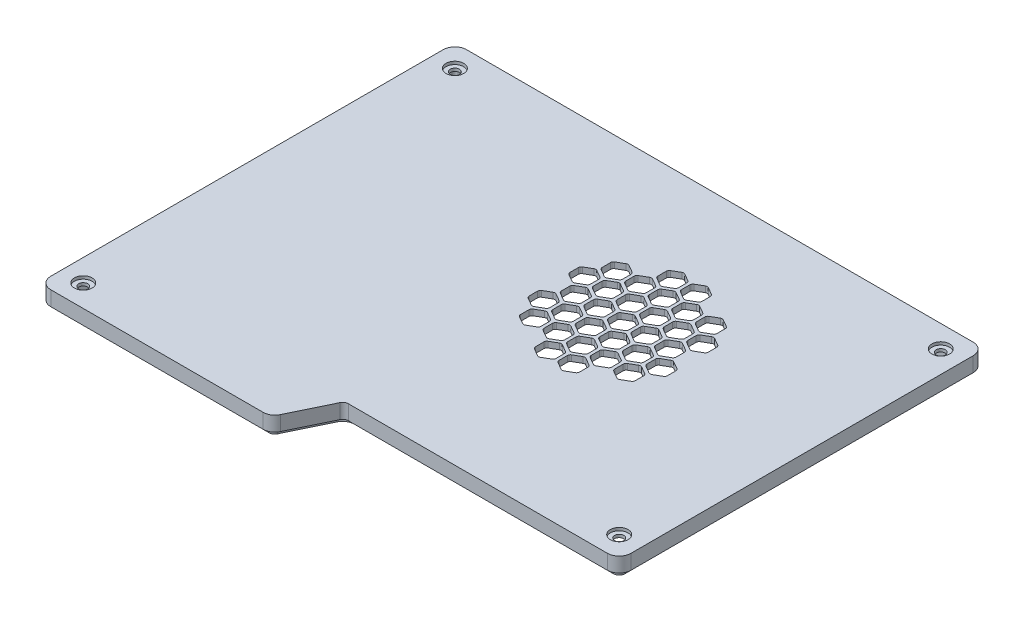
from build123d import *

# Parameters (mm, degrees)
EXTRUDE_1_DEPTH     = 5
CUT_EXTRUDE_1_DEPTH = 3
EXTRUDE_2_DEPTH     = 2
CUT_EXTRUDE_2_DEPTH = 2
FILLET_1_R          = 1
OTHER_START         = 3
OTHER_1_DEPTH       = 2
FILLET_2_R          = 4
FILLET_3_R          = 2
FILLET_4_R          = 1
FILLET_5_R          = 6
SKETCH_8_R          = 1.55
CUT_EXTRUDE_3_DEPTH = 2
SKETCH_9_R          = 3
CUT_EXTRUDE_4_DEPTH = 1


# Read off the part's stored shape, not the designer's step: 填充阵列1
with BuildPart() as part:
    # 草图1 → 凸台-拉伸1 (new body)
    with BuildSketch(Plane(origin=(0, 0, 0), x_dir=(1, 0, 0), z_dir=(0, 1, 0))):
        Polygon((0, 0), (0, 141.2), (180, 141.2), (180, 17), (86.8, 17), (78.6, 0), align=None)
    extrude(amount=EXTRUDE_1_DEPTH)

    # 草图4 → 切除-拉伸1 (cut)
    with BuildSketch(Plane.XZ):
        Polygon((4, -4), (4, -137.2), (176, -137.2), (176, -21), (84.288395017, -21), (76.088395017, -4), align=None)
    extrude(amount=-CUT_EXTRUDE_1_DEPTH, mode=Mode.SUBTRACT)

    # 草图5 → 凸台-拉伸2 (add)
    with BuildSketch(Plane.XZ):
        Polygon((2, -2), (2, -139.2), (178, -139.2), (178, -19), (85.544197508, -19), (77.344197508, -2), align=None)
        Polygon((4, -4), (4, -137.2), (176, -137.2), (176, -21), (84.288395017, -21), (76.088395017, -4), align=None, mode=Mode.SUBTRACT)
    extrude(amount=EXTRUDE_2_DEPTH)

    # 草图7 → 切除-拉伸2 (cut)
    with BuildSketch(Plane.XZ.offset(-3)):
        Polygon((110.5, -91.77), (113.964101615, -89.77), (113.964101615, -85.77), (110.5, -83.77), (107.035898385, -85.77), (107.035898385, -89.77), align=None)
    extrude(amount=-CUT_EXTRUDE_2_DEPTH, mode=Mode.SUBTRACT)

    # 圆角1
    fillet_1_edges = [part.edges().sort_by_distance(p)[0] for p in [
        (110.5, 4, -91.77),
        (107.035898385, 4, -89.77),
        (107.035898385, 4, -85.77),
        (110.5, 4, -83.77),
        (113.964101615, 4, -85.77),
        (113.964101615, 4, -89.77),
    ]]
    fillet(fillet_1_edges, radius=FILLET_1_R)

    # 填充阵列1 outline → 填充阵列1 (cut)
    with BuildSketch(Plane(origin=(0, 0, 0), x_dir=(1, 0, 0), z_dir=(0, 1, 0)).offset(OTHER_START)):
        with BuildLine():
            ThreePointArc((123, 98.409528096), (122.5, 98.543502692), (122, 98.409528096))
            Line((122, 98.409528096), (119.535898385, 96.986878365))
            ThreePointArc((119.535898385, 96.986878365), (119.169872981, 96.620852961), (119.035898385, 96.120852961))
            Line((119.035898385, 96.120852961), (119.035898385, 93.275553499))
            ThreePointArc((119.035898385, 93.275553499), (119.169872981, 92.775553499), (119.535898385, 92.409528096))
            Line((119.535898385, 92.409528096), (122, 90.986878365))
            ThreePointArc((122, 90.986878365), (122.5, 90.852903769), (123, 90.986878365))
            Line((123, 90.986878365), (125.464101615, 92.409528096))
            ThreePointArc((125.464101615, 92.409528096), (125.830127019, 92.775553499), (125.964101615, 93.275553499))
            Line((125.964101615, 93.275553499), (125.964101615, 96.120852961))
            ThreePointArc((125.964101615, 96.120852961), (125.830127019, 96.620852961), (125.464101615, 96.986878365))
            Line((125.464101615, 96.986878365), (123, 98.409528096))
        make_face()
        with BuildLine():
            ThreePointArc((99, 84.553121635), (98.5, 84.687096231), (98, 84.553121635))
            Line((98, 84.553121635), (95.535898385, 83.130471904))
            ThreePointArc((95.535898385, 83.130471904), (95.169872981, 82.764446501), (95.035898385, 82.264446501))
            Line((95.035898385, 82.264446501), (95.035898385, 79.419147039))
            ThreePointArc((95.035898385, 79.419147039), (95.169872981, 78.919147039), (95.535898385, 78.553121635))
            Line((95.535898385, 78.553121635), (98, 77.130471904))
            ThreePointArc((98, 77.130471904), (98.5, 76.996497308), (99, 77.130471904))
            Line((99, 77.130471904), (101.464101615, 78.553121635))
            ThreePointArc((101.464101615, 78.553121635), (101.830127019, 78.919147039), (101.964101615, 79.419147039))
            Line((101.964101615, 79.419147039), (101.964101615, 82.264446501))
            ThreePointArc((101.964101615, 82.264446501), (101.830127019, 82.764446501), (101.464101615, 83.130471904))
            Line((101.464101615, 83.130471904), (99, 84.553121635))
        make_face()
        with BuildLine():
            ThreePointArc((107.535898385, 76.202268674), (107.169872981, 75.83624327), (107.035898385, 75.33624327))
            Line((107.035898385, 75.33624327), (107.035898385, 72.490943809))
            ThreePointArc((107.035898385, 72.490943809), (107.169872981, 71.990943809), (107.535898385, 71.624918405))
            Line((107.535898385, 71.624918405), (110, 70.202268674))
            ThreePointArc((110, 70.202268674), (110.5, 70.068294078), (111, 70.202268674))
            Line((111, 70.202268674), (113.464101615, 71.624918405))
            ThreePointArc((113.464101615, 71.624918405), (113.830127019, 71.990943809), (113.964101615, 72.490943809))
            Line((113.964101615, 72.490943809), (113.964101615, 75.33624327))
            ThreePointArc((113.964101615, 75.33624327), (113.830127019, 75.83624327), (113.464101615, 76.202268674))
            Line((113.464101615, 76.202268674), (111, 77.624918405))
            ThreePointArc((111, 77.624918405), (110.5, 77.758893001), (110, 77.624918405))
            Line((110, 77.624918405), (107.535898385, 76.202268674))
        make_face()
        with BuildLine():
            ThreePointArc((107.535898385, 103.915081595), (107.169872981, 103.549056191), (107.035898385, 103.049056191))
            Line((107.035898385, 103.049056191), (107.035898385, 100.20375673))
            ThreePointArc((107.035898385, 100.20375673), (107.169872981, 99.70375673), (107.535898385, 99.337731326))
            Line((107.535898385, 99.337731326), (110, 97.915081595))
            ThreePointArc((110, 97.915081595), (110.5, 97.781106999), (111, 97.915081595))
            Line((111, 97.915081595), (113.464101615, 99.337731326))
            ThreePointArc((113.464101615, 99.337731326), (113.830127019, 99.70375673), (113.964101615, 100.20375673))
            Line((113.964101615, 100.20375673), (113.964101615, 103.049056191))
            ThreePointArc((113.964101615, 103.049056191), (113.830127019, 103.549056191), (113.464101615, 103.915081595))
            Line((113.464101615, 103.915081595), (111, 105.337731326))
            ThreePointArc((111, 105.337731326), (110.5, 105.471705922), (110, 105.337731326))
            Line((110, 105.337731326), (107.535898385, 103.915081595))
        make_face()
        with BuildLine():
            ThreePointArc((119.035898385, 79.419147039), (119.169872981, 78.919147039), (119.535898385, 78.553121635))
            Line((119.535898385, 78.553121635), (122, 77.130471904))
            ThreePointArc((122, 77.130471904), (122.5, 76.996497308), (123, 77.130471904))
            Line((123, 77.130471904), (125.464101615, 78.553121635))
            ThreePointArc((125.464101615, 78.553121635), (125.830127019, 78.919147039), (125.964101615, 79.419147039))
            Line((125.964101615, 79.419147039), (125.964101615, 82.264446501))
            ThreePointArc((125.964101615, 82.264446501), (125.830127019, 82.764446501), (125.464101615, 83.130471904))
            Line((125.464101615, 83.130471904), (123, 84.553121635))
            ThreePointArc((123, 84.553121635), (122.5, 84.687096231), (122, 84.553121635))
            Line((122, 84.553121635), (119.535898385, 83.130471904))
            ThreePointArc((119.535898385, 83.130471904), (119.169872981, 82.764446501), (119.035898385, 82.264446501))
            Line((119.035898385, 82.264446501), (119.035898385, 79.419147039))
        make_face()
        with BuildLine():
            ThreePointArc((95.035898385, 93.275553499), (95.169872981, 92.775553499), (95.535898385, 92.409528096))
            Line((95.535898385, 92.409528096), (98, 90.986878365))
            ThreePointArc((98, 90.986878365), (98.5, 90.852903769), (99, 90.986878365))
            Line((99, 90.986878365), (101.464101615, 92.409528096))
            ThreePointArc((101.464101615, 92.409528096), (101.830127019, 92.775553499), (101.964101615, 93.275553499))
            Line((101.964101615, 93.275553499), (101.964101615, 96.120852961))
            ThreePointArc((101.964101615, 96.120852961), (101.830127019, 96.620852961), (101.464101615, 96.986878365))
            Line((101.464101615, 96.986878365), (99, 98.409528096))
            ThreePointArc((99, 98.409528096), (98.5, 98.543502692), (98, 98.409528096))
            Line((98, 98.409528096), (95.535898385, 96.986878365))
            ThreePointArc((95.535898385, 96.986878365), (95.169872981, 96.620852961), (95.035898385, 96.120852961))
            Line((95.035898385, 96.120852961), (95.035898385, 93.275553499))
        make_face()
        with BuildLine():
            ThreePointArc((91, 98.409528096), (90.5, 98.543502692), (90, 98.409528096))
            Line((90, 98.409528096), (87.535898385, 96.986878365))
            ThreePointArc((87.535898385, 96.986878365), (87.169872981, 96.620852961), (87.035898385, 96.120852961))
            Line((87.035898385, 96.120852961), (87.035898385, 93.275553499))
            ThreePointArc((87.035898385, 93.275553499), (87.169872981, 92.775553499), (87.535898385, 92.409528096))
            Line((87.535898385, 92.409528096), (90, 90.986878365))
            ThreePointArc((90, 90.986878365), (90.5, 90.852903769), (91, 90.986878365))
            Line((91, 90.986878365), (93.464101615, 92.409528096))
            ThreePointArc((93.464101615, 92.409528096), (93.830127019, 92.775553499), (93.964101615, 93.275553499))
            Line((93.964101615, 93.275553499), (93.964101615, 96.120852961))
            ThreePointArc((93.964101615, 96.120852961), (93.830127019, 96.620852961), (93.464101615, 96.986878365))
            Line((93.464101615, 96.986878365), (91, 98.409528096))
        make_face()
        with BuildLine():
            ThreePointArc((103, 105.337731326), (102.5, 105.471705922), (102, 105.337731326))
            Line((102, 105.337731326), (99.535898385, 103.915081595))
            ThreePointArc((99.535898385, 103.915081595), (99.169872981, 103.549056191), (99.035898385, 103.049056191))
            Line((99.035898385, 103.049056191), (99.035898385, 100.20375673))
            ThreePointArc((99.035898385, 100.20375673), (99.169872981, 99.70375673), (99.535898385, 99.337731326))
            Line((99.535898385, 99.337731326), (102, 97.915081595))
            ThreePointArc((102, 97.915081595), (102.5, 97.781106999), (103, 97.915081595))
            Line((103, 97.915081595), (105.464101615, 99.337731326))
            ThreePointArc((105.464101615, 99.337731326), (105.830127019, 99.70375673), (105.964101615, 100.20375673))
            Line((105.964101615, 100.20375673), (105.964101615, 103.049056191))
            ThreePointArc((105.964101615, 103.049056191), (105.830127019, 103.549056191), (105.464101615, 103.915081595))
            Line((105.464101615, 103.915081595), (103, 105.337731326))
        make_face()
        with BuildLine():
            ThreePointArc((115, 112.265934556), (114.5, 112.399909152), (114, 112.265934556))
            Line((114, 112.265934556), (111.535898385, 110.843284825))
            ThreePointArc((111.535898385, 110.843284825), (111.169872981, 110.477259422), (111.035898385, 109.977259422))
            Line((111.035898385, 109.977259422), (111.035898385, 107.13195996))
            ThreePointArc((111.035898385, 107.13195996), (111.169872981, 106.63195996), (111.535898385, 106.265934556))
            Line((111.535898385, 106.265934556), (114, 104.843284825))
            ThreePointArc((114, 104.843284825), (114.5, 104.709310229), (115, 104.843284825))
            Line((115, 104.843284825), (117.464101615, 106.265934556))
            ThreePointArc((117.464101615, 106.265934556), (117.830127019, 106.63195996), (117.964101615, 107.13195996))
            Line((117.964101615, 107.13195996), (117.964101615, 109.977259422))
            ThreePointArc((117.964101615, 109.977259422), (117.830127019, 110.477259422), (117.464101615, 110.843284825))
            Line((117.464101615, 110.843284825), (115, 112.265934556))
        make_face()
        with BuildLine():
            ThreePointArc((87.535898385, 83.130471904), (87.169872981, 82.764446501), (87.035898385, 82.264446501))
            Line((87.035898385, 82.264446501), (87.035898385, 79.419147039))
            ThreePointArc((87.035898385, 79.419147039), (87.169872981, 78.919147039), (87.535898385, 78.553121635))
            Line((87.535898385, 78.553121635), (90, 77.130471904))
            ThreePointArc((90, 77.130471904), (90.5, 76.996497308), (91, 77.130471904))
            Line((91, 77.130471904), (93.464101615, 78.553121635))
            ThreePointArc((93.464101615, 78.553121635), (93.830127019, 78.919147039), (93.964101615, 79.419147039))
            Line((93.964101615, 79.419147039), (93.964101615, 82.264446501))
            ThreePointArc((93.964101615, 82.264446501), (93.830127019, 82.764446501), (93.464101615, 83.130471904))
            Line((93.464101615, 83.130471904), (91, 84.553121635))
            ThreePointArc((91, 84.553121635), (90.5, 84.687096231), (90, 84.553121635))
            Line((90, 84.553121635), (87.535898385, 83.130471904))
        make_face()
        with BuildLine():
            ThreePointArc((111.035898385, 79.419147039), (111.169872981, 78.919147039), (111.535898385, 78.553121635))
            Line((111.535898385, 78.553121635), (114, 77.130471904))
            ThreePointArc((114, 77.130471904), (114.5, 76.996497308), (115, 77.130471904))
            Line((115, 77.130471904), (117.464101615, 78.553121635))
            ThreePointArc((117.464101615, 78.553121635), (117.830127019, 78.919147039), (117.964101615, 79.419147039))
            Line((117.964101615, 79.419147039), (117.964101615, 82.264446501))
            ThreePointArc((117.964101615, 82.264446501), (117.830127019, 82.764446501), (117.464101615, 83.130471904))
            Line((117.464101615, 83.130471904), (115, 84.553121635))
            ThreePointArc((115, 84.553121635), (114.5, 84.687096231), (114, 84.553121635))
            Line((114, 84.553121635), (111.535898385, 83.130471904))
            ThreePointArc((111.535898385, 83.130471904), (111.169872981, 82.764446501), (111.035898385, 82.264446501))
            Line((111.035898385, 82.264446501), (111.035898385, 79.419147039))
        make_face()
        with BuildLine():
            ThreePointArc((123.035898385, 72.490943809), (123.169872981, 71.990943809), (123.535898385, 71.624918405))
            Line((123.535898385, 71.624918405), (126, 70.202268674))
            ThreePointArc((126, 70.202268674), (126.5, 70.068294078), (127, 70.202268674))
            Line((127, 70.202268674), (129.464101615, 71.624918405))
            ThreePointArc((129.464101615, 71.624918405), (129.830127019, 71.990943809), (129.964101615, 72.490943809))
            Line((129.964101615, 72.490943809), (129.964101615, 75.33624327))
            ThreePointArc((129.964101615, 75.33624327), (129.830127019, 75.83624327), (129.464101615, 76.202268674))
            Line((129.464101615, 76.202268674), (127, 77.624918405))
            ThreePointArc((127, 77.624918405), (126.5, 77.758893001), (126, 77.624918405))
            Line((126, 77.624918405), (123.535898385, 76.202268674))
            ThreePointArc((123.535898385, 76.202268674), (123.169872981, 75.83624327), (123.035898385, 75.33624327))
            Line((123.035898385, 75.33624327), (123.035898385, 72.490943809))
        make_face()
        with BuildLine():
            ThreePointArc((99.035898385, 86.347350269), (99.169872981, 85.847350269), (99.535898385, 85.481324865))
            Line((99.535898385, 85.481324865), (102, 84.058675135))
            ThreePointArc((102, 84.058675135), (102.5, 83.924700538), (103, 84.058675135))
            Line((103, 84.058675135), (105.464101615, 85.481324865))
            ThreePointArc((105.464101615, 85.481324865), (105.830127019, 85.847350269), (105.964101615, 86.347350269))
            Line((105.964101615, 86.347350269), (105.964101615, 89.192649731))
            ThreePointArc((105.964101615, 89.192649731), (105.830127019, 89.692649731), (105.464101615, 90.058675135))
            Line((105.464101615, 90.058675135), (103, 91.481324865))
            ThreePointArc((103, 91.481324865), (102.5, 91.615299462), (102, 91.481324865))
            Line((102, 91.481324865), (99.535898385, 90.058675135))
            ThreePointArc((99.535898385, 90.058675135), (99.169872981, 89.692649731), (99.035898385, 89.192649731))
            Line((99.035898385, 89.192649731), (99.035898385, 86.347350269))
        make_face()
        with BuildLine():
            ThreePointArc((115, 70.696715175), (114.5, 70.830689771), (114, 70.696715175))
            Line((114, 70.696715175), (111.535898385, 69.274065444))
            ThreePointArc((111.535898385, 69.274065444), (111.169872981, 68.90804004), (111.035898385, 68.40804004))
            Line((111.035898385, 68.40804004), (111.035898385, 65.562740578))
            ThreePointArc((111.035898385, 65.562740578), (111.169872981, 65.062740578), (111.535898385, 64.696715175))
            Line((111.535898385, 64.696715175), (114, 63.274065444))
            ThreePointArc((114, 63.274065444), (114.5, 63.140090848), (115, 63.274065444))
            Line((115, 63.274065444), (117.464101615, 64.696715175))
            ThreePointArc((117.464101615, 64.696715175), (117.830127019, 65.062740578), (117.964101615, 65.562740578))
            Line((117.964101615, 65.562740578), (117.964101615, 68.40804004))
            ThreePointArc((117.964101615, 68.40804004), (117.830127019, 68.90804004), (117.464101615, 69.274065444))
            Line((117.464101615, 69.274065444), (115, 70.696715175))
        make_face()
        with BuildLine():
            ThreePointArc((111.535898385, 96.986878365), (111.169872981, 96.620852961), (111.035898385, 96.120852961))
            Line((111.035898385, 96.120852961), (111.035898385, 93.275553499))
            ThreePointArc((111.035898385, 93.275553499), (111.169872981, 92.775553499), (111.535898385, 92.409528096))
            Line((111.535898385, 92.409528096), (114, 90.986878365))
            ThreePointArc((114, 90.986878365), (114.5, 90.852903769), (115, 90.986878365))
            Line((115, 90.986878365), (117.464101615, 92.409528096))
            ThreePointArc((117.464101615, 92.409528096), (117.830127019, 92.775553499), (117.964101615, 93.275553499))
            Line((117.964101615, 93.275553499), (117.964101615, 96.120852961))
            ThreePointArc((117.964101615, 96.120852961), (117.830127019, 96.620852961), (117.464101615, 96.986878365))
            Line((117.464101615, 96.986878365), (115, 98.409528096))
            ThreePointArc((115, 98.409528096), (114.5, 98.543502692), (114, 98.409528096))
            Line((114, 98.409528096), (111.535898385, 96.986878365))
        make_face()
        with BuildLine():
            ThreePointArc((99.035898385, 72.490943809), (99.169872981, 71.990943809), (99.535898385, 71.624918405))
            Line((99.535898385, 71.624918405), (102, 70.202268674))
            ThreePointArc((102, 70.202268674), (102.5, 70.068294078), (103, 70.202268674))
            Line((103, 70.202268674), (105.464101615, 71.624918405))
            ThreePointArc((105.464101615, 71.624918405), (105.830127019, 71.990943809), (105.964101615, 72.490943809))
            Line((105.964101615, 72.490943809), (105.964101615, 75.33624327))
            ThreePointArc((105.964101615, 75.33624327), (105.830127019, 75.83624327), (105.464101615, 76.202268674))
            Line((105.464101615, 76.202268674), (103, 77.624918405))
            ThreePointArc((103, 77.624918405), (102.5, 77.758893001), (102, 77.624918405))
            Line((102, 77.624918405), (99.535898385, 76.202268674))
            ThreePointArc((99.535898385, 76.202268674), (99.169872981, 75.83624327), (99.035898385, 75.33624327))
            Line((99.035898385, 75.33624327), (99.035898385, 72.490943809))
        make_face()
        with BuildLine():
            ThreePointArc((119, 77.624918405), (118.5, 77.758893001), (118, 77.624918405))
            Line((118, 77.624918405), (115.535898385, 76.202268674))
            ThreePointArc((115.535898385, 76.202268674), (115.169872981, 75.83624327), (115.035898385, 75.33624327))
            Line((115.035898385, 75.33624327), (115.035898385, 72.490943809))
            ThreePointArc((115.035898385, 72.490943809), (115.169872981, 71.990943809), (115.535898385, 71.624918405))
            Line((115.535898385, 71.624918405), (118, 70.202268674))
            ThreePointArc((118, 70.202268674), (118.5, 70.068294078), (119, 70.202268674))
            Line((119, 70.202268674), (121.464101615, 71.624918405))
            ThreePointArc((121.464101615, 71.624918405), (121.830127019, 71.990943809), (121.964101615, 72.490943809))
            Line((121.964101615, 72.490943809), (121.964101615, 75.33624327))
            ThreePointArc((121.964101615, 75.33624327), (121.830127019, 75.83624327), (121.464101615, 76.202268674))
            Line((121.464101615, 76.202268674), (119, 77.624918405))
        make_face()
        with BuildLine():
            ThreePointArc((107, 70.696715175), (106.5, 70.830689771), (106, 70.696715175))
            Line((106, 70.696715175), (103.535898385, 69.274065444))
            ThreePointArc((103.535898385, 69.274065444), (103.169872981, 68.90804004), (103.035898385, 68.40804004))
            Line((103.035898385, 68.40804004), (103.035898385, 65.562740578))
            ThreePointArc((103.035898385, 65.562740578), (103.169872981, 65.062740578), (103.535898385, 64.696715175))
            Line((103.535898385, 64.696715175), (106, 63.274065444))
            ThreePointArc((106, 63.274065444), (106.5, 63.140090848), (107, 63.274065444))
            Line((107, 63.274065444), (109.464101615, 64.696715175))
            ThreePointArc((109.464101615, 64.696715175), (109.830127019, 65.062740578), (109.964101615, 65.562740578))
            Line((109.964101615, 65.562740578), (109.964101615, 68.40804004))
            ThreePointArc((109.964101615, 68.40804004), (109.830127019, 68.90804004), (109.464101615, 69.274065444))
            Line((109.464101615, 69.274065444), (107, 70.696715175))
        make_face()
        with BuildLine():
            ThreePointArc((131, 84.553121635), (130.5, 84.687096231), (130, 84.553121635))
            Line((130, 84.553121635), (127.535898385, 83.130471904))
            ThreePointArc((127.535898385, 83.130471904), (127.169872981, 82.764446501), (127.035898385, 82.264446501))
            Line((127.035898385, 82.264446501), (127.035898385, 79.419147039))
            ThreePointArc((127.035898385, 79.419147039), (127.169872981, 78.919147039), (127.535898385, 78.553121635))
            Line((127.535898385, 78.553121635), (130, 77.130471904))
            ThreePointArc((130, 77.130471904), (130.5, 76.996497308), (131, 77.130471904))
            Line((131, 77.130471904), (133.464101615, 78.553121635))
            ThreePointArc((133.464101615, 78.553121635), (133.830127019, 78.919147039), (133.964101615, 79.419147039))
            Line((133.964101615, 79.419147039), (133.964101615, 82.264446501))
            ThreePointArc((133.964101615, 82.264446501), (133.830127019, 82.764446501), (133.464101615, 83.130471904))
            Line((133.464101615, 83.130471904), (131, 84.553121635))
        make_face()
        with BuildLine():
            ThreePointArc((115.535898385, 90.058675135), (115.169872981, 89.692649731), (115.035898385, 89.192649731))
            Line((115.035898385, 89.192649731), (115.035898385, 86.347350269))
            ThreePointArc((115.035898385, 86.347350269), (115.169872981, 85.847350269), (115.535898385, 85.481324865))
            Line((115.535898385, 85.481324865), (118, 84.058675135))
            ThreePointArc((118, 84.058675135), (118.5, 83.924700538), (119, 84.058675135))
            Line((119, 84.058675135), (121.464101615, 85.481324865))
            ThreePointArc((121.464101615, 85.481324865), (121.830127019, 85.847350269), (121.964101615, 86.347350269))
            Line((121.964101615, 86.347350269), (121.964101615, 89.192649731))
            ThreePointArc((121.964101615, 89.192649731), (121.830127019, 89.692649731), (121.464101615, 90.058675135))
            Line((121.464101615, 90.058675135), (119, 91.481324865))
            ThreePointArc((119, 91.481324865), (118.5, 91.615299462), (118, 91.481324865))
            Line((118, 91.481324865), (115.535898385, 90.058675135))
        make_face()
        with BuildLine():
            ThreePointArc((115.535898385, 103.915081595), (115.169872981, 103.549056191), (115.035898385, 103.049056191))
            Line((115.035898385, 103.049056191), (115.035898385, 100.20375673))
            ThreePointArc((115.035898385, 100.20375673), (115.169872981, 99.70375673), (115.535898385, 99.337731326))
            Line((115.535898385, 99.337731326), (118, 97.915081595))
            ThreePointArc((118, 97.915081595), (118.5, 97.781106999), (119, 97.915081595))
            Line((119, 97.915081595), (121.464101615, 99.337731326))
            ThreePointArc((121.464101615, 99.337731326), (121.830127019, 99.70375673), (121.964101615, 100.20375673))
            Line((121.964101615, 100.20375673), (121.964101615, 103.049056191))
            ThreePointArc((121.964101615, 103.049056191), (121.830127019, 103.549056191), (121.464101615, 103.915081595))
            Line((121.464101615, 103.915081595), (119, 105.337731326))
            ThreePointArc((119, 105.337731326), (118.5, 105.471705922), (118, 105.337731326))
            Line((118, 105.337731326), (115.535898385, 103.915081595))
        make_face()
        with BuildLine():
            ThreePointArc((91.035898385, 86.347350269), (91.169872981, 85.847350269), (91.535898385, 85.481324865))
            Line((91.535898385, 85.481324865), (94, 84.058675135))
            ThreePointArc((94, 84.058675135), (94.5, 83.924700538), (95, 84.058675135))
            Line((95, 84.058675135), (97.464101615, 85.481324865))
            ThreePointArc((97.464101615, 85.481324865), (97.830127019, 85.847350269), (97.964101615, 86.347350269))
            Line((97.964101615, 86.347350269), (97.964101615, 89.192649731))
            ThreePointArc((97.964101615, 89.192649731), (97.830127019, 89.692649731), (97.464101615, 90.058675135))
            Line((97.464101615, 90.058675135), (95, 91.481324865))
            ThreePointArc((95, 91.481324865), (94.5, 91.615299462), (94, 91.481324865))
            Line((94, 91.481324865), (91.535898385, 90.058675135))
            ThreePointArc((91.535898385, 90.058675135), (91.169872981, 89.692649731), (91.035898385, 89.192649731))
            Line((91.035898385, 89.192649731), (91.035898385, 86.347350269))
        make_face()
        with BuildLine():
            ThreePointArc((103.035898385, 79.419147039), (103.169872981, 78.919147039), (103.535898385, 78.553121635))
            Line((103.535898385, 78.553121635), (106, 77.130471904))
            ThreePointArc((106, 77.130471904), (106.5, 76.996497308), (107, 77.130471904))
            Line((107, 77.130471904), (109.464101615, 78.553121635))
            ThreePointArc((109.464101615, 78.553121635), (109.830127019, 78.919147039), (109.964101615, 79.419147039))
            Line((109.964101615, 79.419147039), (109.964101615, 82.264446501))
            ThreePointArc((109.964101615, 82.264446501), (109.830127019, 82.764446501), (109.464101615, 83.130471904))
            Line((109.464101615, 83.130471904), (107, 84.553121635))
            ThreePointArc((107, 84.553121635), (106.5, 84.687096231), (106, 84.553121635))
            Line((106, 84.553121635), (103.535898385, 83.130471904))
            ThreePointArc((103.535898385, 83.130471904), (103.169872981, 82.764446501), (103.035898385, 82.264446501))
            Line((103.035898385, 82.264446501), (103.035898385, 79.419147039))
        make_face()
        with BuildLine():
            ThreePointArc((127, 105.337731326), (126.5, 105.471705922), (126, 105.337731326))
            Line((126, 105.337731326), (123.535898385, 103.915081595))
            ThreePointArc((123.535898385, 103.915081595), (123.169872981, 103.549056191), (123.035898385, 103.049056191))
            Line((123.035898385, 103.049056191), (123.035898385, 100.20375673))
            ThreePointArc((123.035898385, 100.20375673), (123.169872981, 99.70375673), (123.535898385, 99.337731326))
            Line((123.535898385, 99.337731326), (126, 97.915081595))
            ThreePointArc((126, 97.915081595), (126.5, 97.781106999), (127, 97.915081595))
            Line((127, 97.915081595), (129.464101615, 99.337731326))
            ThreePointArc((129.464101615, 99.337731326), (129.830127019, 99.70375673), (129.964101615, 100.20375673))
            Line((129.964101615, 100.20375673), (129.964101615, 103.049056191))
            ThreePointArc((129.964101615, 103.049056191), (129.830127019, 103.549056191), (129.464101615, 103.915081595))
            Line((129.464101615, 103.915081595), (127, 105.337731326))
        make_face()
        with BuildLine():
            ThreePointArc((123.535898385, 90.058675135), (123.169872981, 89.692649731), (123.035898385, 89.192649731))
            Line((123.035898385, 89.192649731), (123.035898385, 86.347350269))
            ThreePointArc((123.035898385, 86.347350269), (123.169872981, 85.847350269), (123.535898385, 85.481324865))
            Line((123.535898385, 85.481324865), (126, 84.058675135))
            ThreePointArc((126, 84.058675135), (126.5, 83.924700538), (127, 84.058675135))
            Line((127, 84.058675135), (129.464101615, 85.481324865))
            ThreePointArc((129.464101615, 85.481324865), (129.830127019, 85.847350269), (129.964101615, 86.347350269))
            Line((129.964101615, 86.347350269), (129.964101615, 89.192649731))
            ThreePointArc((129.964101615, 89.192649731), (129.830127019, 89.692649731), (129.464101615, 90.058675135))
            Line((129.464101615, 90.058675135), (127, 91.481324865))
            ThreePointArc((127, 91.481324865), (126.5, 91.615299462), (126, 91.481324865))
            Line((126, 91.481324865), (123.535898385, 90.058675135))
        make_face()
        with BuildLine():
            ThreePointArc((103.535898385, 110.843284825), (103.169872981, 110.477259422), (103.035898385, 109.977259422))
            Line((103.035898385, 109.977259422), (103.035898385, 107.13195996))
            ThreePointArc((103.035898385, 107.13195996), (103.169872981, 106.63195996), (103.535898385, 106.265934556))
            Line((103.535898385, 106.265934556), (106, 104.843284825))
            ThreePointArc((106, 104.843284825), (106.5, 104.709310229), (107, 104.843284825))
            Line((107, 104.843284825), (109.464101615, 106.265934556))
            ThreePointArc((109.464101615, 106.265934556), (109.830127019, 106.63195996), (109.964101615, 107.13195996))
            Line((109.964101615, 107.13195996), (109.964101615, 109.977259422))
            ThreePointArc((109.964101615, 109.977259422), (109.830127019, 110.477259422), (109.464101615, 110.843284825))
            Line((109.464101615, 110.843284825), (107, 112.265934556))
            ThreePointArc((107, 112.265934556), (106.5, 112.399909152), (106, 112.265934556))
            Line((106, 112.265934556), (103.535898385, 110.843284825))
        make_face()
        with BuildLine():
            ThreePointArc((103.535898385, 96.986878365), (103.169872981, 96.620852961), (103.035898385, 96.120852961))
            Line((103.035898385, 96.120852961), (103.035898385, 93.275553499))
            ThreePointArc((103.035898385, 93.275553499), (103.169872981, 92.775553499), (103.535898385, 92.409528096))
            Line((103.535898385, 92.409528096), (106, 90.986878365))
            ThreePointArc((106, 90.986878365), (106.5, 90.852903769), (107, 90.986878365))
            Line((107, 90.986878365), (109.464101615, 92.409528096))
            ThreePointArc((109.464101615, 92.409528096), (109.830127019, 92.775553499), (109.964101615, 93.275553499))
            Line((109.964101615, 93.275553499), (109.964101615, 96.120852961))
            ThreePointArc((109.964101615, 96.120852961), (109.830127019, 96.620852961), (109.464101615, 96.986878365))
            Line((109.464101615, 96.986878365), (107, 98.409528096))
            ThreePointArc((107, 98.409528096), (106.5, 98.543502692), (106, 98.409528096))
            Line((106, 98.409528096), (103.535898385, 96.986878365))
        make_face()
        with BuildLine():
            ThreePointArc((91.035898385, 72.490943809), (91.169872981, 71.990943809), (91.535898385, 71.624918405))
            Line((91.535898385, 71.624918405), (94, 70.202268674))
            ThreePointArc((94, 70.202268674), (94.5, 70.068294078), (95, 70.202268674))
            Line((95, 70.202268674), (97.464101615, 71.624918405))
            ThreePointArc((97.464101615, 71.624918405), (97.830127019, 71.990943809), (97.964101615, 72.490943809))
            Line((97.964101615, 72.490943809), (97.964101615, 75.33624327))
            ThreePointArc((97.964101615, 75.33624327), (97.830127019, 75.83624327), (97.464101615, 76.202268674))
            Line((97.464101615, 76.202268674), (95, 77.624918405))
            ThreePointArc((95, 77.624918405), (94.5, 77.758893001), (94, 77.624918405))
            Line((94, 77.624918405), (91.535898385, 76.202268674))
            ThreePointArc((91.535898385, 76.202268674), (91.169872981, 75.83624327), (91.035898385, 75.33624327))
            Line((91.035898385, 75.33624327), (91.035898385, 72.490943809))
        make_face()
        with BuildLine():
            ThreePointArc((131, 98.409528096), (130.5, 98.543502692), (130, 98.409528096))
            Line((130, 98.409528096), (127.535898385, 96.986878365))
            ThreePointArc((127.535898385, 96.986878365), (127.169872981, 96.620852961), (127.035898385, 96.120852961))
            Line((127.035898385, 96.120852961), (127.035898385, 93.275553499))
            ThreePointArc((127.035898385, 93.275553499), (127.169872981, 92.775553499), (127.535898385, 92.409528096))
            Line((127.535898385, 92.409528096), (130, 90.986878365))
            ThreePointArc((130, 90.986878365), (130.5, 90.852903769), (131, 90.986878365))
            Line((131, 90.986878365), (133.464101615, 92.409528096))
            ThreePointArc((133.464101615, 92.409528096), (133.830127019, 92.775553499), (133.964101615, 93.275553499))
            Line((133.964101615, 93.275553499), (133.964101615, 96.120852961))
            ThreePointArc((133.964101615, 96.120852961), (133.830127019, 96.620852961), (133.464101615, 96.986878365))
            Line((133.464101615, 96.986878365), (131, 98.409528096))
        make_face()
        with BuildLine():
            ThreePointArc((91.035898385, 100.20375673), (91.169872981, 99.70375673), (91.535898385, 99.337731326))
            Line((91.535898385, 99.337731326), (94, 97.915081595))
            ThreePointArc((94, 97.915081595), (94.5, 97.781106999), (95, 97.915081595))
            Line((95, 97.915081595), (97.464101615, 99.337731326))
            ThreePointArc((97.464101615, 99.337731326), (97.830127019, 99.70375673), (97.964101615, 100.20375673))
            Line((97.964101615, 100.20375673), (97.964101615, 103.049056191))
            ThreePointArc((97.964101615, 103.049056191), (97.830127019, 103.549056191), (97.464101615, 103.915081595))
            Line((97.464101615, 103.915081595), (95, 105.337731326))
            ThreePointArc((95, 105.337731326), (94.5, 105.471705922), (94, 105.337731326))
            Line((94, 105.337731326), (91.535898385, 103.915081595))
            ThreePointArc((91.535898385, 103.915081595), (91.169872981, 103.549056191), (91.035898385, 103.049056191))
            Line((91.035898385, 103.049056191), (91.035898385, 100.20375673))
        make_face()
    extrude(amount=OTHER_1_DEPTH, mode=Mode.SUBTRACT)

    # 圆角2
    fillet_2_edges = [part.edges().sort_by_distance(p)[0] for p in [
        (0, 2.5, 0),
        (0, 2.5, -141.2),
        (180, 2.5, -141.2),
        (180, 2.5, -17),
        (78.6, 2.5, 0),
        (85.544197508, -1, -19),
    ]]
    fillet(fillet_2_edges, radius=FILLET_2_R)

    # 圆角3
    fillet_3_edges = [part.edges().sort_by_distance(p)[0] for p in [
        (86.8, 2.5, -17),
        (77.344197508, -1, -2),
        (2, -1, -2),
        (2, -1, -139.2),
        (178, -1, -139.2),
        (178, -1, -19),
    ]]
    fillet(fillet_3_edges, radius=FILLET_3_R)

    # 圆角4
    fillet_4_edges = [part.edges().sort_by_distance(p)[0] for p in [
        (4, 0.5, -4),
        (76.088395017, 0.5, -4),
        (176, 0.5, -21),
        (176, 0.5, -137.2),
        (4, 0.5, -137.2),
    ]]
    fillet(fillet_4_edges, radius=FILLET_4_R)

    # 圆角5
    fillet_5_edges = [part.edges().sort_by_distance(p)[0] for p in [
        (84.288395017, 0.5, -21),
    ]]
    fillet(fillet_5_edges, radius=FILLET_5_R)

    # 草图8 → 切除-拉伸3 (cut)
    with BuildSketch(Plane.XZ.offset(-3)):
        with Locations(Location((7.5, -7.5, 0), (0, 0, 270))):
            Circle(SKETCH_8_R)
        with Locations(Location((172.5, -24.5, 0), (0, 0, 270))):
            Circle(SKETCH_8_R)
        with Locations(Location((172.5, -133.7, 0), (0, 0, 270))):
            Circle(SKETCH_8_R)
        with Locations(Location((7.5, -133.7, 0), (0, 0, 270))):
            Circle(SKETCH_8_R)
    extrude(amount=-CUT_EXTRUDE_3_DEPTH, mode=Mode.SUBTRACT)

    # 草图9 → 切除-拉伸4 (cut)
    with BuildSketch(Plane(origin=(0, 5, 0), x_dir=(1, 0, 0), z_dir=(0, 1, 0))):
        with Locations(Location((7.5, 133.7, 0), (0, 0, 270))):
            Circle(SKETCH_9_R)
        with Locations(Location((172.5, 133.7, 0), (0, 0, 270))):
            Circle(SKETCH_9_R)
        with Locations(Location((172.5, 24.5, 0), (0, 0, 270))):
            Circle(SKETCH_9_R)
        with Locations(Location((7.5, 7.5, 0), (0, 0, 270))):
            Circle(SKETCH_9_R)
    extrude(amount=-CUT_EXTRUDE_4_DEPTH, mode=Mode.SUBTRACT)


solid = part.part
